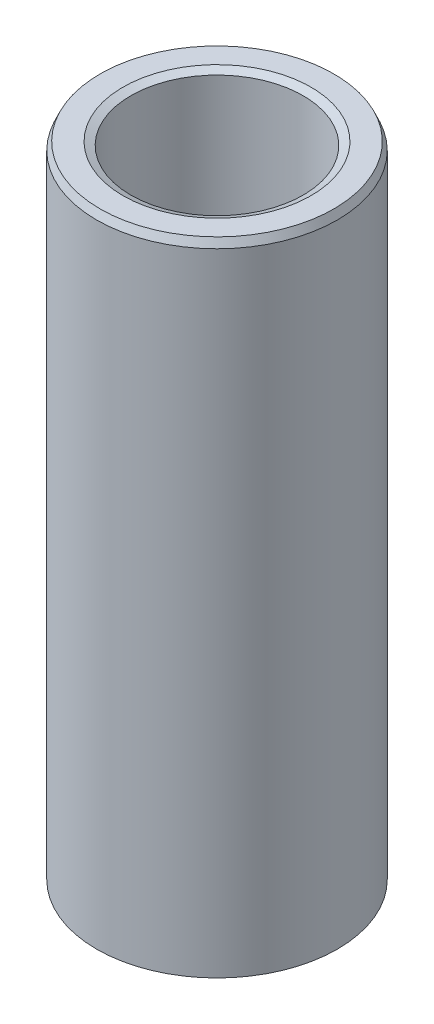
from build123d import *
from OCP.BRepFilletAPI import BRepFilletAPI_MakeChamfer

# Parameters (mm, degrees)
SKETCH1_R           = 55
BOSS_EXTRUDE1_DEPTH = 293.691769746
SKETCH2_R           = 39.365705554
CUT_EXTRUDE1_DEPTH  = 304.817141742
CHAMFER1_SIZE       = 3.596695099
CHAMFER1_SIZE2      = 1.580746994


with BuildPart() as part:
    # Sketch1 → Boss-Extrude1 (new body)
    with BuildSketch(Plane(origin=(0, 0, 0), x_dir=(1, 0, 0), z_dir=(0, 1, 0))):
        Circle(SKETCH1_R)
    extrude(amount=BOSS_EXTRUDE1_DEPTH)

    # Sketch2 → Cut-Extrude1 (cut, through all)
    with BuildSketch(Plane(origin=(0, 0, 0), x_dir=(1, 0, 0), z_dir=(0, 1, 0))):
        Circle(SKETCH2_R)
    extrude(amount=CUT_EXTRUDE1_DEPTH, mode=Mode.SUBTRACT)

    # Chamfer1: one chamfer whose edges measure the first distance from different faces: ONE call of the kernel's chamfer builder (chamfer() names one face for all edges)
    chamfer1_edges_1 = [part.edges().sort_by_distance(p)[0] for p in [
        (-39.365705554, 293.691769746, 0),
    ]]
    chamfer1_side_1 = [part.faces().sort_by_distance(p)[0] for p in [
        (-53.444365081, 293.691769746, 0),
    ]]
    chamfer1_edges_2 = [part.edges().sort_by_distance(p)[0] for p in [
        (-39.365705554, 0, 0),
    ]]
    chamfer1_side_2 = [part.faces().sort_by_distance(p)[0] for p in [
        (-39.365705554, 146.845884873, 0),
    ]]
    chamfer1_edges_3 = [part.edges().sort_by_distance(p)[0] for p in [
        (-55, 0, 0),
    ]]
    chamfer1_side_3 = [part.faces().sort_by_distance(p)[0] for p in [
        (-53.444365081, 0, 0),
    ]]
    chamfer1_edges_4 = [part.edges().sort_by_distance(p)[0] for p in [
        (-55, 293.691769746, 0),
    ]]
    chamfer1_side_4 = [part.faces().sort_by_distance(p)[0] for p in [
        (-55, 146.845884873, 0),
    ]]
    chamfer1 = BRepFilletAPI_MakeChamfer(part.part.solid().wrapped)
    for e in chamfer1_edges_1:
        chamfer1.Add(CHAMFER1_SIZE, CHAMFER1_SIZE2, e.wrapped, chamfer1_side_1[0].wrapped)  # the first distance lies on this face
    for e in chamfer1_edges_2:
        chamfer1.Add(CHAMFER1_SIZE, CHAMFER1_SIZE2, e.wrapped, chamfer1_side_2[0].wrapped)  # the first distance lies on this face
    for e in chamfer1_edges_3:
        chamfer1.Add(CHAMFER1_SIZE, CHAMFER1_SIZE2, e.wrapped, chamfer1_side_3[0].wrapped)  # the first distance lies on this face
    for e in chamfer1_edges_4:
        chamfer1.Add(CHAMFER1_SIZE, CHAMFER1_SIZE2, e.wrapped, chamfer1_side_4[0].wrapped)  # the first distance lies on this face
    add(Compound.cast(chamfer1.Shape()), mode=Mode.REPLACE)


solid = part.part
